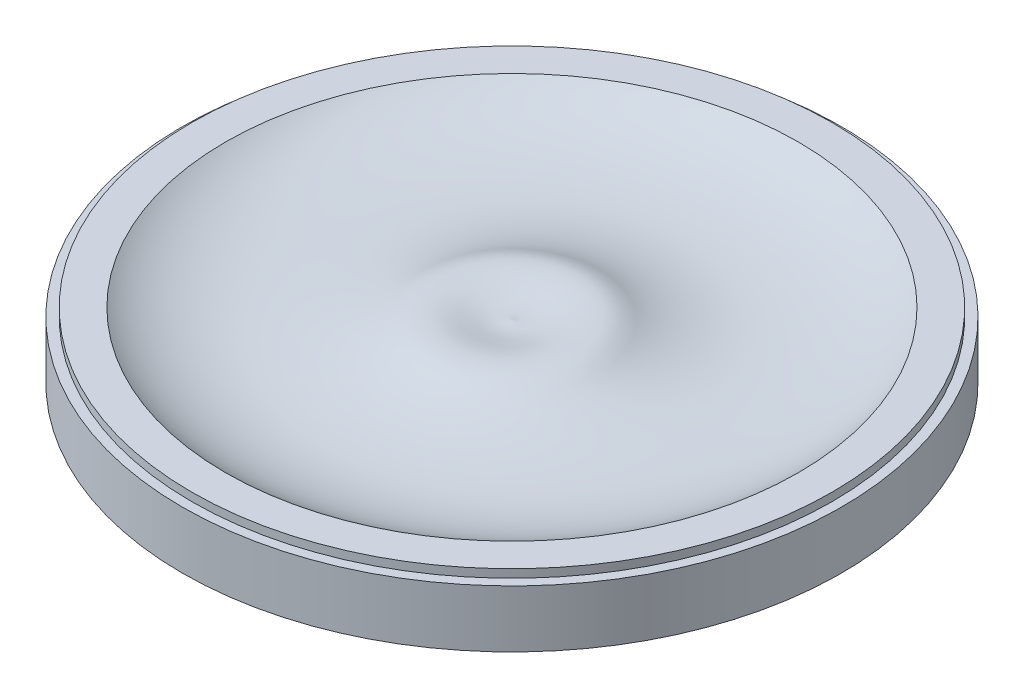
from build123d import *
from build123d.topology import SkipClean

# Parameters (mm, degrees)
BOSS_EXTRUDE1_DEPTH = 0.75
SKETCH4_RX          = 1.303717269
SKETCH4_RY          = 0.905346041
BOSS_EXTRUDE2_DEPTH = 0.1
FILLET1_R           = 0.1


with BuildPart() as part:
    # Sketch1 → Revolve1 (revolve)
    with BuildSketch(Plane(origin=(0, 0, 0), x_dir=(0, 0, -1), z_dir=(1, 0, 0)), mode=Mode.PRIVATE) as revolve1_sk:
        Polygon((0, 2.675), (0, -2.675), (6.65, -2.675), (6.65, -1.105), (12.5, -1.105), (12.5, -0.105), (14, -0.105), (14, 2.325), (13.6, 2.325), (13.6, 2.675), align=None)
    revolve(revolve1_sk.sketch.rotate(Axis((0, 2.675, 0), (0, -1, 0)), 180), axis=Axis((0, 2.675, 0), (0, -1, 0)))

    # Sketch2 → Cut-Revolve1 (revolve, cut)
    with BuildSketch(Plane.XY):
        with BuildLine():
            Line((12.167843198, 2.675), (12.167843198, 4.188369308))
            Line((12.167843198, 4.188369308), (0, 4.188369308))
            Line((0, 4.188369308), (0, 2.20930679))
            add(Edge.make_bspline(
                [(0, 2.20930679), (0.697493383, 2.096114571), (1.712976925, 2.479358765), (3.089812768, 2.524529264), (5.522613834, 1.273374007), (10.13555892, 1.104929536), (12.167843198, 2.675)],
                knots=[0, 0, 0, 0, 0.198883602, 0.334629802, 0.396962893, 1, 1, 1, 1], degree=3))
        make_face()
    revolve(axis=Axis((0, -2.675, 0), (0, 1, 0)), mode=Mode.SUBTRACT)

    # Sketch3 → Boss-Extrude1 (add)
    with SkipClean():  # the faces are left unmerged after this step: merging them gives an invalid solid
        with BuildSketch(Plane.XZ.offset(1.105)):
            with BuildLine():
                Line((6.125, -7.261843774), (8.059210526, -9.555057598))
                ThreePointArc((8.059210526, -9.555057598), (0, -12.5), (-8.059210526, -9.555057598))
                Line((-8.059210526, -9.555057598), (-6.125, -7.261843774))
                ThreePointArc((-6.125, -7.261843774), (0, -9.5), (6.125, -7.261843774))
            make_face()
        extrude(amount=BOSS_EXTRUDE1_DEPTH)

    # Sketch4 → Boss-Extrude2 (add)
    with SkipClean():  # the faces are left unmerged after this step: merging them gives an invalid solid
        with BuildSketch(Plane.XZ.offset(1.855)):
            with Locations(Location((6.168922757, -8.940301825), (0, 0, -55.097504384))):
                Ellipse(SKETCH4_RX, SKETCH4_RY)
            with Locations(Location((-6.168922757, -8.940301825), (0, 0, -124.902495616))):
                Ellipse(SKETCH4_RX, SKETCH4_RY)
        extrude(amount=BOSS_EXTRUDE2_DEPTH)

    # Fillet1
    fillet1_edges = [part.edges().sort_by_distance(p)[0] for p in [
        (5.42295973, -1.955, -7.871088152),
        (-5.42295973, -1.955, -7.871088152),
    ]]
    fillet(fillet1_edges, radius=FILLET1_R - 0.0001)  # a hair under: the kernel refuses the full size


solid = part.part
